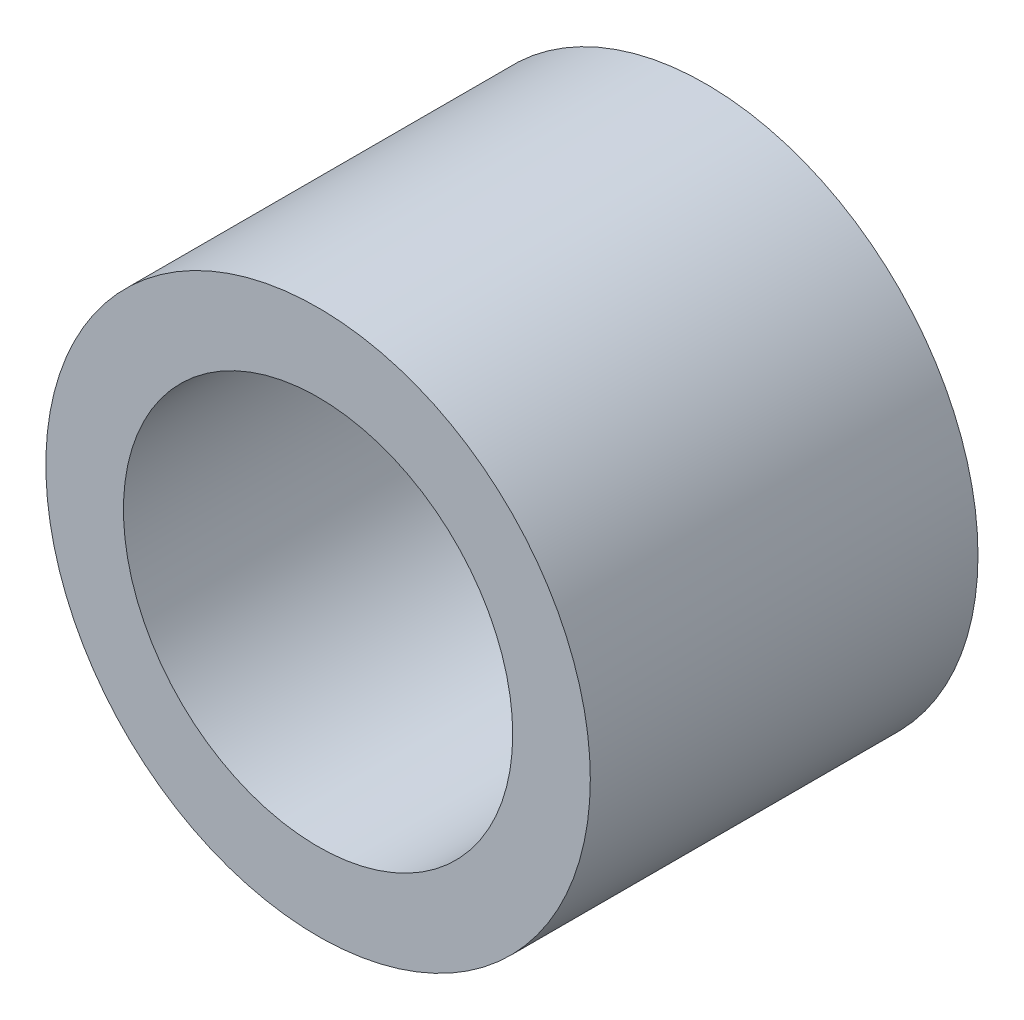
from build123d import *

# Parameters (mm, degrees)
SKETCH1_R           = 5.55625
SKETCH1_R_2         = 3.97256
BOSS_EXTRUDE1_DEPTH = 7.9121


with BuildPart() as part:
    # Sketch1 → Boss-Extrude1 (new body)
    with BuildSketch(Plane.XY):
        Circle(SKETCH1_R)
        Circle(SKETCH1_R_2, mode=Mode.SUBTRACT)
    extrude(amount=BOSS_EXTRUDE1_DEPTH)


solid = part.part
